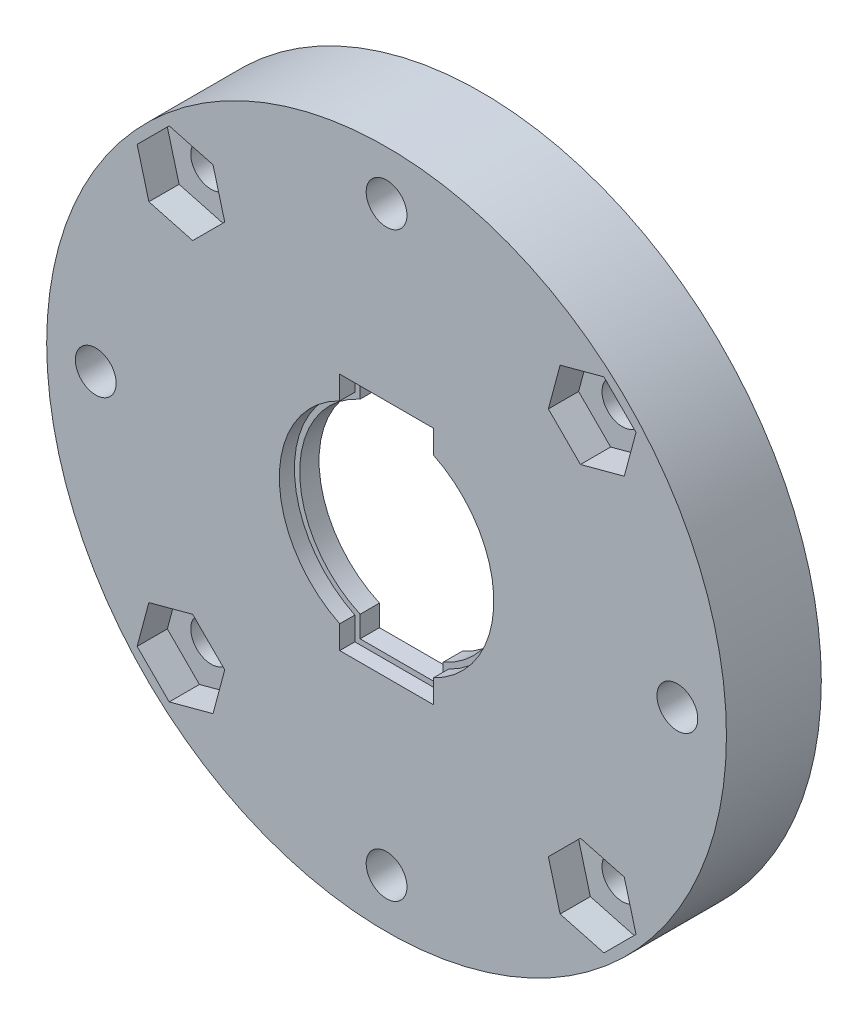
from build123d import *

# Parameters (mm, degrees)
SKETCH3_R           = 22.5
BOSS_EXTRUDE2_DEPTH = 1
SKETCH4_R           = 22.5
BOSS_EXTRUDE3_DEPTH = 5.28
SKETCH5_R           = 17.25
CUT_EXTRUDE1_DEPTH  = 4
CUT_EXTRUDE2_DEPTH  = 2
SKETCH8_R           = 1.35
CUT_EXTRUDE4_DEPTH  = 33.433599862
CIRPATTERN1_COUNT   = 4
CIRPATTERN2_COUNT   = 8


with BuildPart() as part:
    # Sketch3 → Boss-Extrude2 (new body)
    with BuildSketch(Plane.XY):
        Circle(SKETCH3_R)
        with BuildLine():
            Line((-3.099988, -6.387493593), (-3.099988, -7.924679))
            Line((-3.099988, -7.924679), (3.100012, -7.924679))
            Line((3.100012, -7.924679), (3.100012, -6.387481945))
            ThreePointArc((3.100012, -6.387481945), (7.1, 0), (3.100012, 6.387481945))
            Line((3.100012, 6.387481945), (3.100012, 7.924431))
            Line((3.100012, 7.924431), (-3.099988, 7.924431))
            Line((-3.099988, 7.924431), (-3.099988, 6.387493593))
            ThreePointArc((-3.099988, 6.387493593), (-7.1, 0), (-3.099988, -6.387493593))
        make_face(mode=Mode.SUBTRACT)
    extrude(amount=-BOSS_EXTRUDE2_DEPTH)

    # Sketch4 → Boss-Extrude3 (add)
    with BuildSketch(Plane(origin=(0, 0, -1), x_dir=(-1, 0, 0), z_dir=(0, 0, -1))):
        Circle(SKETCH4_R)
        with BuildLine():
            Line((2.749988, 6.164419356), (2.749988, 7.574431))
            Line((2.749988, 7.574431), (-2.750012, 7.574431))
            Line((-2.750012, 7.574431), (-2.750012, 6.16440865))
            ThreePointArc((-2.750012, 6.16440865), (-6.75, 0), (-2.750012, -6.16440865))
            Line((-2.750012, -6.16440865), (-2.750012, -7.574679))
            Line((-2.750012, -7.574679), (2.749988, -7.574679))
            Line((2.749988, -7.574679), (2.749988, -6.164419356))
            ThreePointArc((2.749988, -6.164419356), (6.75, 0), (2.749988, 6.164419356))
        make_face(mode=Mode.SUBTRACT)
    extrude(amount=BOSS_EXTRUDE3_DEPTH)

    # Sketch5 → Cut-Extrude1 (cut)
    with BuildSketch(Plane(origin=(0, 0, -6.28), x_dir=(-1, 0, 0), z_dir=(0, 0, -1))):
        Circle(SKETCH5_R)
    extrude(amount=-CUT_EXTRUDE1_DEPTH, mode=Mode.SUBTRACT)

    # Sketch6 → Cut-Extrude2 (cut)
    with BuildSketch(Plane.XY):
        Polygon((14.388837614, 16.511728724), (11.488914427, 15.734696648), (10.711882352, 12.834773462), (12.834773462, 10.711882352), (15.734696648, 11.488914427), (16.511728724, 14.388837614), align=None)
    cut_extrude2 = extrude(amount=-CUT_EXTRUDE2_DEPTH, mode=Mode.SUBTRACT)

    # Sketch8 → Cut-Extrude4 (cut, through all)
    with BuildSketch(Plane.XY):
        with Locations((13.611805538, 13.611805538)):
            Circle(SKETCH8_R)
    cut_extrude4 = extrude(amount=-CUT_EXTRUDE4_DEPTH, mode=Mode.SUBTRACT)

    # CirPattern1: Cut-Extrude2, Cut-Extrude4 ×4 about axis
    cirpattern1_axis = Axis((0, 0, -6.594), (0, 0, 1))
    add([cut_extrude2.rotate(cirpattern1_axis, i * 360 / CIRPATTERN1_COUNT) for i in range(1, CIRPATTERN1_COUNT)], mode=Mode.SUBTRACT)
    add([cut_extrude4.rotate(cirpattern1_axis, i * 360 / CIRPATTERN1_COUNT) for i in range(1, CIRPATTERN1_COUNT)], mode=Mode.SUBTRACT)

    # CirPattern2: Cut-Extrude4 ×8 about axis
    cirpattern2_axis = Axis((0, 0, -6.594), (0, 0, 1))
    for i in range(1, CIRPATTERN2_COUNT):
        add(cut_extrude4.rotate(cirpattern2_axis, i * 360 / CIRPATTERN2_COUNT), mode=Mode.SUBTRACT)


solid = part.part
